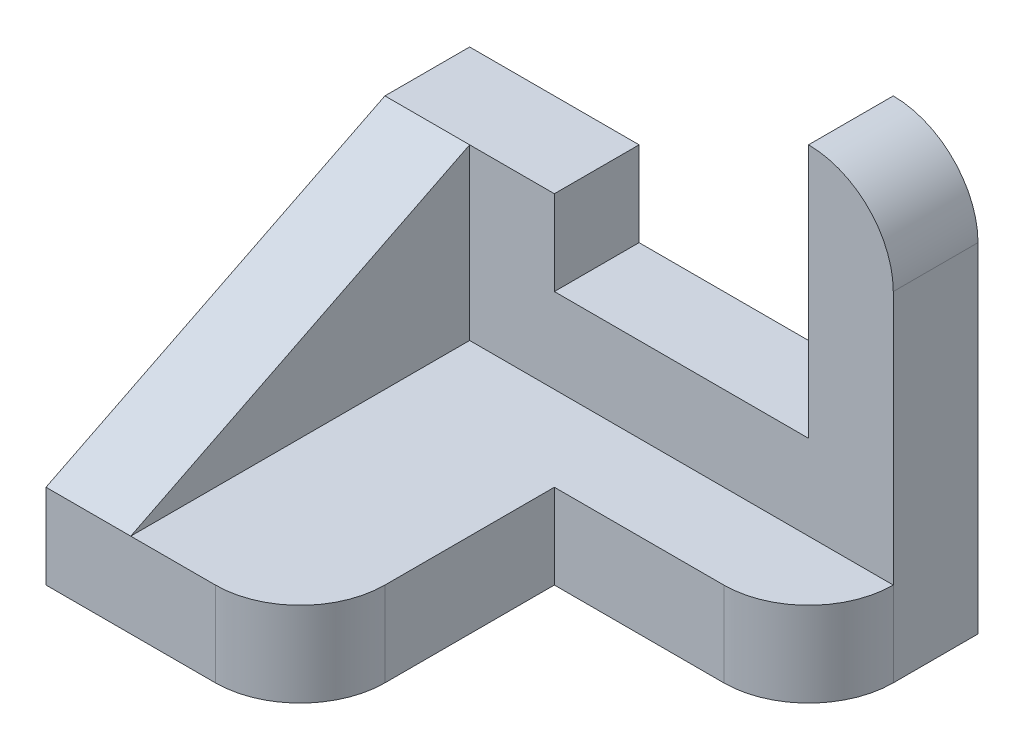
from build123d import *

# Parameters (mm, degrees)
SKETCH_1_W      = 2
SKETCH_1_H      = 1
SKETCH_1_W_2    = 3
SKETCH_1_W_3    = 1
EXTRUDE_1_DEPTH = 1
SKETCH_1_3_W    = 3
SKETCH_1_3_H    = 1
EXTRUDE_2_DEPTH = 2
SKETCH_1_4_W    = 2
SKETCH_1_4_H    = 1
EXTRUDE_3_DEPTH = 3
SKETCH_1_5_W    = 1
SKETCH_1_5_H    = 1
EXTRUDE_4_DEPTH = 5
FILLET_1_R      = 1
EXTRUDE_5_DEPTH = 1


with BuildPart() as part:
    # 草圖1 → 填料-伸長1 (new body)
    with BuildSketch(Plane(origin=(0, 0, 0), x_dir=(1, 0, 0), z_dir=(0, 1, 0))):
        with Locations((1, 4.5)):
            Rectangle(SKETCH_1_W, SKETCH_1_H)
        with BuildLine():
            Line((0, 4), (0, 0))
            Line((0, 0), (2, 0))
            ThreePointArc((2, 0), (2.707106781, 0.292893219), (3, 1))
            Line((3, 1), (3, 3))
            Line((3, 3), (5, 3))
            ThreePointArc((5, 3), (5.707106781, 3.292893219), (6, 4))
            Line((6, 4), (5, 4))
            Line((5, 4), (2, 4))
            Line((2, 4), (0, 4))
        make_face()
        with Locations((3.5, 4.5)):
            Rectangle(SKETCH_1_W_2, SKETCH_1_H)
        with Locations((5.5, 4.5)):
            Rectangle(SKETCH_1_W_3, SKETCH_1_H)
    extrude(amount=EXTRUDE_1_DEPTH)

    # 草圖1<3> → 填料-伸長2 (add)
    with BuildSketch(Plane(origin=(0, 0, 0), x_dir=(1, 0, 0), z_dir=(0, 1, 0))):
        with Locations((3.5, 4.5)):
            Rectangle(SKETCH_1_3_W, SKETCH_1_3_H)
    extrude(amount=EXTRUDE_2_DEPTH)

    # 草圖1<4> → 填料-伸長3 (add)
    with BuildSketch(Plane(origin=(0, 0, 0), x_dir=(1, 0, 0), z_dir=(0, 1, 0))):
        with Locations((1, 4.5)):
            Rectangle(SKETCH_1_4_W, SKETCH_1_4_H)
    extrude(amount=EXTRUDE_3_DEPTH)

    # 草圖1<5> → 填料-伸長4 (add)
    with BuildSketch(Plane(origin=(0, 0, 0), x_dir=(1, 0, 0), z_dir=(0, 1, 0))):
        with Locations((5.5, 4.5)):
            Rectangle(SKETCH_1_5_W, SKETCH_1_5_H)
    extrude(amount=EXTRUDE_4_DEPTH)

    # 圓角1
    fillet_1_edges = [part.edges().sort_by_distance(p)[0] for p in [
        (6, 5, -4.5),
    ]]
    fillet(fillet_1_edges, radius=FILLET_1_R - 0.0001)  # a hair under: the kernel refuses the full size

    # 草圖2 → 填料-伸長5 (add)
    with BuildSketch(Plane(origin=(0, 0, 0), x_dir=(0, 0, -1), z_dir=(1, 0, 0))):
        Polygon((0, 1), (4, 3), (4, 1), align=None)
    extrude(amount=EXTRUDE_5_DEPTH)


solid = part.part
